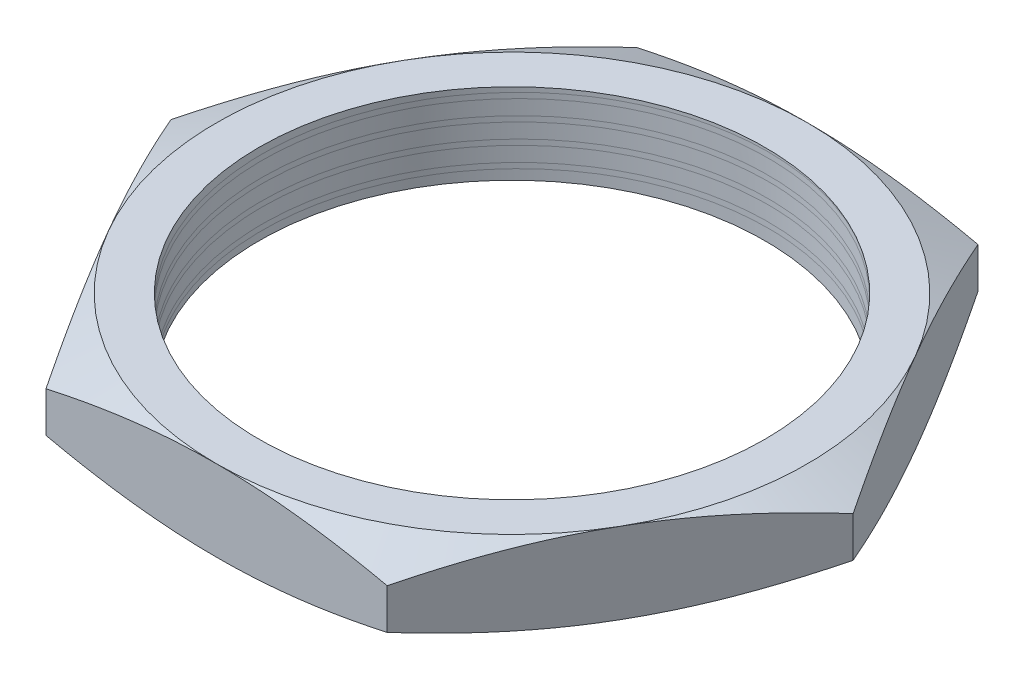
from build123d import *

# Parameters (mm, degrees)
SKETCH1_R            = 6
BOSS_EXTRUDE1_DEPTH  = 2
CUT_SWEEP1_OUTLINE_R = 6
CUT_SWEEP1_DEPTH     = 2


# Read off the part's stored shape, not the designer's step: Cut-Sweep1
with BuildPart() as part:
    # Sketch1 → Boss-Extrude1 (new body)
    with BuildSketch(Plane(origin=(0, 0, 0), x_dir=(1, 0, 0), z_dir=(0, 1, 0))):
        Polygon((8.42931393, 0), (4.214656965, 7.3), (-4.214656965, 7.3), (-8.42931393, 0), (-4.214656965, -7.3), (4.214656965, -7.3), align=None)
        with Locations(Location((0, 0, 0), (0, 0, 270))):
            Circle(SKETCH1_R, mode=Mode.SUBTRACT)
    extrude(amount=BOSS_EXTRUDE1_DEPTH)

    # Sketch3 → Cut-Revolve1 (revolve, cut)
    with BuildSketch(Plane.XY):
        Polygon((-8.42931393, 0), (-8.42931393, 0.5), (-7.3, 0), align=None)
        Polygon((-8.42931393, 2), (-8.42931393, 1.5), (-7.3, 2), align=None)
    revolve(axis=Axis((0, 0, 0), (0, 1, 0)), mode=Mode.SUBTRACT)

    # Cut-Sweep1 outline → Cut-Sweep1 (cut)
    with BuildSketch(Plane(origin=(0, 0, 0), x_dir=(1, 0, 0), z_dir=(0, 1, 0))):
        with BuildLine():
            ThreePointArc((4.207228142, -4.621875307), (-0.67017838, 6.213964993), (-3.125, -5.412658774))
            ThreePointArc((-3.125, -5.412658774), (0.67017838, -6.213964993), (4.207228142, -4.621875307))
        make_face()
        Circle(CUT_SWEEP1_OUTLINE_R, mode=Mode.SUBTRACT)
    extrude(amount=CUT_SWEEP1_DEPTH, mode=Mode.SUBTRACT)


solid = part.part
